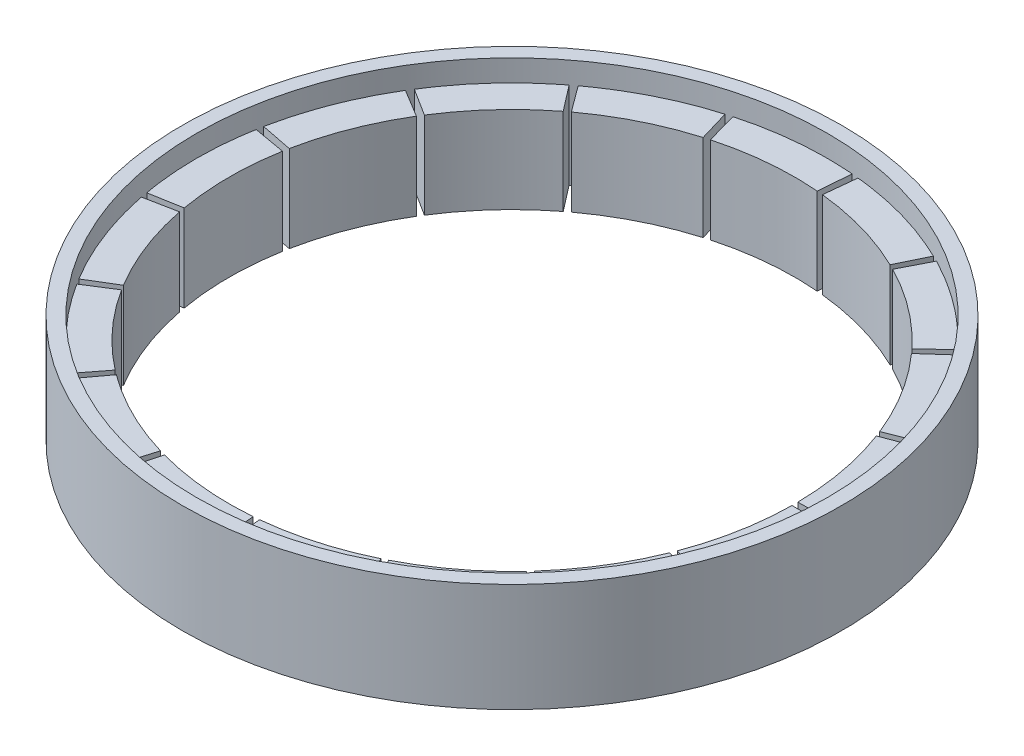
from build123d import *

# Parameters (mm, degrees)
SKETCH1_W         = 1.3
SKETCH1_H         = 10
SKETCH2_W         = 3
SKETCH2_H         = 8
REVOLVE2_ANGLE    = 20
CIRPATTERN2_COUNT = 17


with BuildPart() as part:
    # Sketch1 → Revolve1 (revolve)
    with BuildSketch(Plane.XY):
        with Locations((-29.75, 11.75)):
            Rectangle(SKETCH1_W, SKETCH1_H)
    revolve(axis=Axis((0, 0, 0), (0, -1, 0)))


with BuildPart() as body_2:
    # Sketch2 → Revolve2 (revolve, symmetric)
    with BuildSketch(Plane.XY) as revolve2_sk:
        with Locations((-27.6, 10.75)):
            Rectangle(SKETCH2_W, SKETCH2_H)
    revolve(axis=Axis((0, 0, 0), (0, 1, 0)), revolution_arc=REVOLVE2_ANGLE / 2)
    revolve(revolve2_sk.sketch, axis=Axis((0, 0, 0), (0, -1, 0)), revolution_arc=REVOLVE2_ANGLE / 2)


with BuildPart() as cirpattern2_1:
    # CirPattern2: pattern copy
    add(body_2.part.rotate(Axis((0, 0, 0), (0, 1, 0)), 1 * 360 / CIRPATTERN2_COUNT))


with BuildPart() as cirpattern2_2:
    # CirPattern2: pattern copy
    add(body_2.part.rotate(Axis((0, 0, 0), (0, 1, 0)), 2 * 360 / CIRPATTERN2_COUNT))


with BuildPart() as cirpattern2_3:
    # CirPattern2: pattern copy
    add(body_2.part.rotate(Axis((0, 0, 0), (0, 1, 0)), 3 * 360 / CIRPATTERN2_COUNT))


with BuildPart() as cirpattern2_4:
    # CirPattern2: pattern copy
    add(body_2.part.rotate(Axis((0, 0, 0), (0, 1, 0)), 4 * 360 / CIRPATTERN2_COUNT))


with BuildPart() as cirpattern2_5:
    # CirPattern2: pattern copy
    add(body_2.part.rotate(Axis((0, 0, 0), (0, 1, 0)), 5 * 360 / CIRPATTERN2_COUNT))


with BuildPart() as cirpattern2_6:
    # CirPattern2: pattern copy
    add(body_2.part.rotate(Axis((0, 0, 0), (0, 1, 0)), 6 * 360 / CIRPATTERN2_COUNT))


with BuildPart() as cirpattern2_7:
    # CirPattern2: pattern copy
    add(body_2.part.rotate(Axis((0, 0, 0), (0, 1, 0)), 7 * 360 / CIRPATTERN2_COUNT))


with BuildPart() as cirpattern2_8:
    # CirPattern2: pattern copy
    add(body_2.part.rotate(Axis((0, 0, 0), (0, 1, 0)), 8 * 360 / CIRPATTERN2_COUNT))


with BuildPart() as cirpattern2_9:
    # CirPattern2: pattern copy
    add(body_2.part.rotate(Axis((0, 0, 0), (0, 1, 0)), 9 * 360 / CIRPATTERN2_COUNT))


with BuildPart() as cirpattern2_10:
    # CirPattern2: pattern copy
    add(body_2.part.rotate(Axis((0, 0, 0), (0, 1, 0)), 10 * 360 / CIRPATTERN2_COUNT))


with BuildPart() as cirpattern2_11:
    # CirPattern2: pattern copy
    add(body_2.part.rotate(Axis((0, 0, 0), (0, 1, 0)), 11 * 360 / CIRPATTERN2_COUNT))


with BuildPart() as cirpattern2_12:
    # CirPattern2: pattern copy
    add(body_2.part.rotate(Axis((0, 0, 0), (0, 1, 0)), 12 * 360 / CIRPATTERN2_COUNT))


with BuildPart() as cirpattern2_13:
    # CirPattern2: pattern copy
    add(body_2.part.rotate(Axis((0, 0, 0), (0, 1, 0)), 13 * 360 / CIRPATTERN2_COUNT))


with BuildPart() as cirpattern2_14:
    # CirPattern2: pattern copy
    add(body_2.part.rotate(Axis((0, 0, 0), (0, 1, 0)), 14 * 360 / CIRPATTERN2_COUNT))


with BuildPart() as cirpattern2_15:
    # CirPattern2: pattern copy
    add(body_2.part.rotate(Axis((0, 0, 0), (0, 1, 0)), 15 * 360 / CIRPATTERN2_COUNT))


with BuildPart() as cirpattern2_16:
    # CirPattern2: pattern copy
    add(body_2.part.rotate(Axis((0, 0, 0), (0, 1, 0)), 16 * 360 / CIRPATTERN2_COUNT))


solid = Compound([part.part, body_2.part, cirpattern2_1.part, cirpattern2_2.part, cirpattern2_3.part, cirpattern2_4.part, cirpattern2_5.part, cirpattern2_6.part, cirpattern2_7.part, cirpattern2_8.part, cirpattern2_9.part, cirpattern2_10.part, cirpattern2_11.part, cirpattern2_12.part, cirpattern2_13.part, cirpattern2_14.part, cirpattern2_15.part, cirpattern2_16.part])
